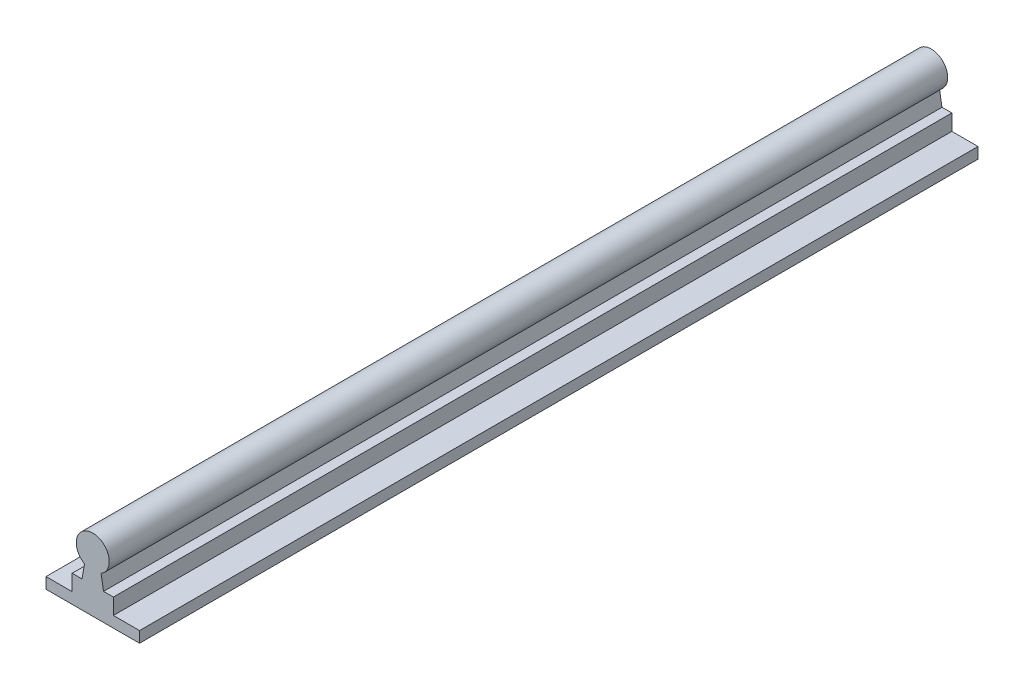
from build123d import *

# Parameters (mm, degrees)
BOSS_EXTRUDE1_DEPTH = 304.8


with BuildPart() as part:
    # Sketch1 → Boss-Extrude1 (new body)
    with BuildSketch(Plane.XY):
        with BuildLine():
            Line((21.307457755, 0), (-12.692542245, 0))
            Line((-12.692542245, 0), (-12.692542245, 4))
            Line((-12.692542245, 4), (-3.192542245, 4))
            Line((-3.192542245, 4), (-3.192542245, 9.8))
            Line((-3.192542245, 9.8), (0.390557455, 9.8))
            Line((0.390557455, 9.8), (1.307457755, 15))
            ThreePointArc((1.307457755, 15), (4.307457755, 26.196152423), (7.307457755, 15))
            Line((7.307457755, 15), (8.224358055, 9.8))
            Line((8.224358055, 9.8), (11.807457755, 9.8))
            Line((11.807457755, 9.8), (11.807457755, 4))
            Line((11.807457755, 4), (21.307457755, 4))
            Line((21.307457755, 4), (21.307457755, 0))
        make_face()
    extrude(amount=BOSS_EXTRUDE1_DEPTH)


solid = part.part
